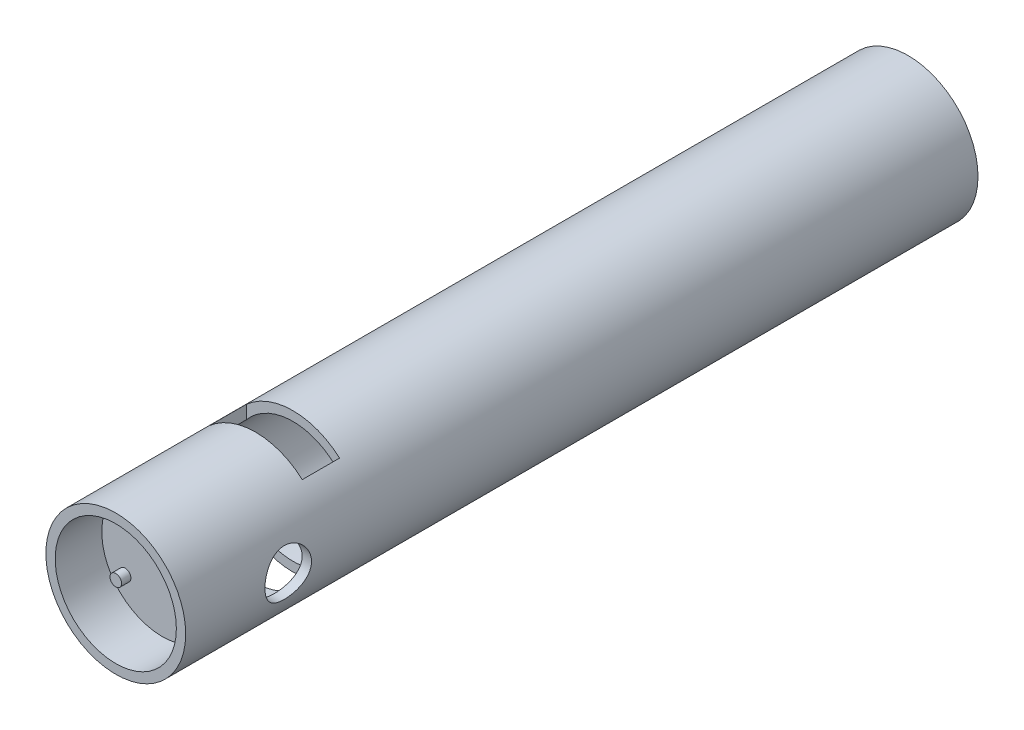
from build123d import *

# Parameters (mm, degrees)
ESBO_O2_R                  = 13
CORTE_EXTRUS_O1_DEPTH      = 172.31841699
ESBO_O3_R                  = 13
RESSALTO_EXTRUS_O1_DEPTH   = 5
ESBO_O4_R                  = 1.25
RESSALTO_EXTRUS_O2_DEPTH   = 2
CORTE_EXTRUS_O2_REACH      = 163.4
ESBO_O5_W                  = 20
ESBO_O5_H                  = 3
CORTE_EXTRUS_O3_DEPTH      = 113.026782512
CORTE_EXTRUS_O3_DEPTH_BACK = 113.026782512
ESBO_O6_R                  = 5
CORTE_EXTRUS_O4_DEPTH      = 113.026782637
CORTE_EXTRUS_O4_DEPTH_BACK = 113.026782637


with BuildPart() as part:
    # Esboço1 → Revolução1 (revolve)
    with BuildSketch(Plane(origin=(0, 0, 0), x_dir=(0, 0, -1), z_dir=(1, 0, 0))):
        Polygon((-60, 0), (60, 0), (110, 0), (110, 15), (60, 15), (-60, 15), align=None)
    revolve(axis=Axis((0, 0, 60), (0, 0, -1)))

    # Esboço2 → Corte-extrusão1 (cut, through all)
    with BuildSketch(Plane.XY.offset(60)):
        Circle(ESBO_O2_R)
    extrude(amount=-CORTE_EXTRUS_O1_DEPTH, mode=Mode.SUBTRACT)



with BuildPart() as body_2:
    # Esboço3 → Ressalto-extrusão1 (new body)
    with BuildSketch(Plane.XY.offset(50)):
        Circle(ESBO_O3_R)
    extrude(amount=-RESSALTO_EXTRUS_O1_DEPTH)


with BuildPart() as part_1:
    add(part.part)

    add(body_2.part)  # Ressalto-extrusão2 merges body 2
    # Esboço4 → Ressalto-extrusão2 (add)
    with BuildSketch(Plane.XY.offset(50)):
        with Locations((-8, -5.5)):
            Circle(ESBO_O4_R)
        with Locations((8, -5.5)):
            Circle(ESBO_O4_R)
    extrude(amount=RESSALTO_EXTRUS_O2_DEPTH)

    # Esboço5 → Corte-extrusão2 (cut, up to next)
    with BuildSketch(Plane.XY.offset(50), mode=Mode.PRIVATE) as corte_extrus_o2_sk1:
        with Locations((0, 6)):
            Rectangle(ESBO_O5_W, ESBO_O5_H)
    corte_extrus_o2_tool1 = extrude(corte_extrus_o2_sk1.sketch, amount=-CORTE_EXTRUS_O2_REACH, mode=Mode.PRIVATE) & part_1.part
    add(corte_extrus_o2_tool1.solids().sort_by_distance((0, 6, 50))[0], mode=Mode.SUBTRACT)

    # Esboço6 → Corte-extrusão3 (cut, two sides: drawn at the far end of the back side and taken through both)
    with BuildSketch(Plane(origin=(0, 0, 0), x_dir=(0, 0, -1), z_dir=(1, 0, 0)).offset(-CORTE_EXTRUS_O3_DEPTH_BACK)):
        with Locations((-38, 0)):
            Circle(ESBO_O6_R)
    extrude(amount=CORTE_EXTRUS_O3_DEPTH + CORTE_EXTRUS_O3_DEPTH_BACK, mode=Mode.SUBTRACT)

    # Esboço7 → Corte-extrusão4 (cut, two sides: drawn at the far end of the back side and taken through both)
    with BuildSketch(Plane(origin=(0, 0, 0), x_dir=(1, 0, 0), z_dir=(0, 1, 0)).offset(-CORTE_EXTRUS_O4_DEPTH_BACK)):
        Polygon((0, -21.98446587), (10, -21.98446587), (10, -29.98446587), (-10, -29.98446587), (-10, -21.98446587), align=None)
    extrude(amount=CORTE_EXTRUS_O4_DEPTH + CORTE_EXTRUS_O4_DEPTH_BACK, mode=Mode.SUBTRACT)


solid = part_1.part
